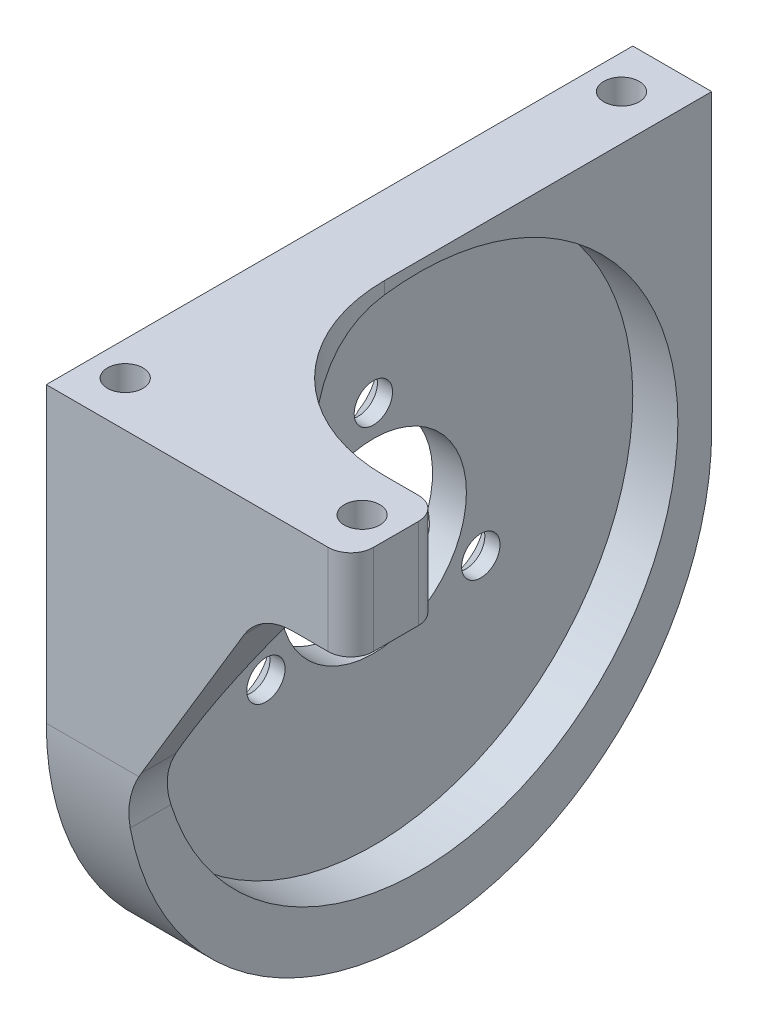
from build123d import *
from OCP.BRepFilletAPI import BRepFilletAPI_MakeChamfer

# Parameters (mm, degrees)
ESBO_O1_W                                      = 52
ESBO_O1_H                                      = 52
RESSALTO_EXTRUS_O1_DEPTH                       = 7
ESBO_O2_R                                      = 8.25
CORTE_EXTRUS_O1_DEPTH                          = 74.87151007
ESCAREADO_PARA_SFHCS_M31_D                     = 3.4
ESCAREADO_PARA_SFHCS_M31_CSINK_D               = 6.72
ESCAREADO_PARA_SFHCS_M31_CSINK_ANGLE           = 90
PADR_OCIRCULAR1_COUNT                          = 3
ESBO_O27_R                                     = 23
CORTE_EXTRUS_O5_DEPTH                          = 4
FILETE1_R                                      = 26
FURO_ROSCADO_PARA_CONDU_TE_DE_M3X0_51_AT_COUNT = 2
FURO_ROSCADO_PARA_CONDU_TE_DE_M3X0_51_AT_PITCH = 44
ESBO_O35_W                                     = 20
ESBO_O35_H                                     = 52
RESSALTO_EXTRUS_O2_DEPTH                       = 8
ESBO_O37_R                                     = 23
CORTE_EXTRUS_O6_DEPTH                          = 77.210235533
CHANFRO1_SIZE                                  = 12
CHANFRO1_SIZE2                                 = 20
FILETE2_R                                      = 10
FILETE3_R                                      = 5
CORTE_EXTRUS_O7_REACH                          = 80.339
ESBO_O39_W                                     = 20
ESBO_O39_H                                     = 36
FILETE5_R                                      = 15
FILETE6_R                                      = 2
CORTE_EXTRUS_O9_REACH                          = 80.339
ESBO_O43_W                                     = 39.515082023
ESBO_O43_H                                     = 58.102579794


with BuildPart() as part:
    # Esboço1 → Ressalto-extrusão1 (new body)
    with BuildSketch(Plane(origin=(0, 0, 0), x_dir=(0, 0, -1), z_dir=(1, 0, 0))):
        with Locations((26, 26)):
            Rectangle(ESBO_O1_W, ESBO_O1_H)
    extrude(amount=RESSALTO_EXTRUS_O1_DEPTH)

    # Esboço2 → Corte-extrusão1 (cut, through all)
    with BuildSketch(Plane.ZY):
        with Locations((-26, 28.1)):
            Circle(ESBO_O2_R)
    extrude(amount=-CORTE_EXTRUS_O1_DEPTH, mode=Mode.SUBTRACT)

    # Escareado para SFHCS M31 (through all)
    with Locations(Plane.ZY):
        with Locations((-26, 39.1)):
            escareado_para_sfhcs_m31 = CounterSinkHole(ESCAREADO_PARA_SFHCS_M31_D / 2, ESCAREADO_PARA_SFHCS_M31_CSINK_D / 2, counter_sink_angle=ESCAREADO_PARA_SFHCS_M31_CSINK_ANGLE)

    # PadrãoCircular1: Escareado para SFHCS M31 ×3 about axis
    padr_ocircular1_axis = Axis((0, 28.1, -26), (1, 0, 0))
    for i in range(1, PADR_OCIRCULAR1_COUNT):
        add(escareado_para_sfhcs_m31.rotate(padr_ocircular1_axis, i * 360 / PADR_OCIRCULAR1_COUNT), mode=Mode.SUBTRACT)

    # Esboço27 → Corte-extrusão5 (cut)
    with BuildSketch(Plane(origin=(7, 0, 0), x_dir=(0, 0, -1), z_dir=(1, 0, 0))):
        with Locations((26, 28.1)):
            Circle(ESBO_O27_R)
    extrude(amount=-CORTE_EXTRUS_O5_DEPTH, mode=Mode.SUBTRACT)

    # Filete1
    filete1_edges = [part.edges().sort_by_distance(p)[0] for p in [
        (3.5, 0, -52),
        (3.5, 0, 0),
    ]]
    fillet(filete1_edges, radius=FILETE1_R - 0.0001)  # a hair under: the kernel refuses the full size

    # Esboço34 → Furo roscado para conduíte de M3x0.51 (revolve, cut)
    with BuildSketch(Plane(origin=(3, 52, -48), x_dir=(0, 0, 1), z_dir=(1, 0, 0))):
        Polygon((0, 0), (0, 10.946355475), (1.575, 10), (1.575, 0), align=None)
    furo_roscado_para_condu_te_de_m3x0_51 = revolve(axis=Axis((3, 58.35, -48), (0, -1, 0)), mode=Mode.SUBTRACT)

    # Furo roscado para conduíte de M3x0.51 at: Furo roscado para conduíte de M3x0.51 ×2
    with Locations(*[(0, 0, i * FURO_ROSCADO_PARA_CONDU_TE_DE_M3X0_51_AT_PITCH) for i in range(1, FURO_ROSCADO_PARA_CONDU_TE_DE_M3X0_51_AT_COUNT)]):
        add(furo_roscado_para_condu_te_de_m3x0_51, mode=Mode.SUBTRACT)

    # Esboço35 → Ressalto-extrusão2 (add)
    with BuildSketch(Plane(origin=(0, 52, 0), x_dir=(1, 0, 0), z_dir=(0, 1, 0))):
        with Locations((17, 26)):
            Rectangle(ESBO_O35_W, ESBO_O35_H)
    extrude(amount=-RESSALTO_EXTRUS_O2_DEPTH)

    # Esboço37 → Corte-extrusão6 (cut, through all)
    with BuildSketch(Plane(origin=(7, 0, 0), x_dir=(0, 0, -1), z_dir=(1, 0, 0))):
        with Locations((26, 28.1)):
            Circle(ESBO_O37_R)
    extrude(amount=CORTE_EXTRUS_O6_DEPTH, mode=Mode.SUBTRACT)

    # Chanfro1: one chamfer whose edges measure the first distance from different faces: ONE call of the kernel's chamfer builder (chamfer() names one face for all edges)
    chanfro1_edges_1 = [part.edges().sort_by_distance(p)[0] for p in [
        (7, 44, -47.309482535),
    ]]
    chanfro1_side_1 = [part.faces().sort_by_distance(p)[0] for p in [
        (17, 44, -47.309482535),
    ]]
    chanfro1_edges_2 = [part.edges().sort_by_distance(p)[0] for p in [
        (7, 44, -4.690517465),
    ]]
    chanfro1_side_2 = [part.faces().sort_by_distance(p)[0] for p in [
        (17, 44, -4.690517465),
    ]]
    chanfro1 = BRepFilletAPI_MakeChamfer(part.part.solid().wrapped)
    for e in chanfro1_edges_1:
        chanfro1.Add(CHANFRO1_SIZE, CHANFRO1_SIZE2, e.wrapped, chanfro1_side_1[0].wrapped)  # the first distance lies on this face
    for e in chanfro1_edges_2:
        chanfro1.Add(CHANFRO1_SIZE, CHANFRO1_SIZE2, e.wrapped, chanfro1_side_2[0].wrapped)  # the first distance lies on this face
    add(Compound.cast(chanfro1.Shape()), mode=Mode.REPLACE)

    # Filete2
    filete2_edges = [part.edges().sort_by_distance(p)[0] for p in [
        (7, 24, -1.722707367),
        (7, 24, -50.277292633),
    ]]
    fillet(filete2_edges, radius=FILETE2_R)

    # Filete3
    filete3_edges = [part.edges().sort_by_distance(p)[0] for p in [
        (19, 44, -4.690517465),
        (19, 44, -47.309482535),
    ]]
    fillet(filete3_edges, radius=FILETE3_R)

    # Espelhar1: Furo roscado para conduíte de M3x0.51 across plane
    add(furo_roscado_para_condu_te_de_m3x0_51.mirror(Plane.ZY.offset(-13.5)), mode=Mode.SUBTRACT)

    # Espelhar1 copy 1 sketch → Espelhar1 copy 1 (revolve, cut)
    with BuildSketch(Plane(origin=(24, 52, -4), x_dir=(0, 0, 1), z_dir=(-1, 0, 0))):
        Polygon((0, 0), (0, -10.946355475), (1.575, -10), (1.575, 0), align=None)
    revolve(axis=Axis((24, 58.35, -4), (0, 1, 0)), mode=Mode.SUBTRACT)

    # Esboço39 → Corte-extrusão7 (cut, up to next)
    with BuildSketch(Plane(origin=(0, 52, 0), x_dir=(1, 0, 0), z_dir=(0, 1, 0)), mode=Mode.PRIVATE) as corte_extrus_o7_sk1:
        with Locations((17, 26)):
            Rectangle(ESBO_O39_W, ESBO_O39_H)
    corte_extrus_o7_tool1 = extrude(corte_extrus_o7_sk1.sketch, amount=-CORTE_EXTRUS_O7_REACH, mode=Mode.PRIVATE) & part.part
    add(corte_extrus_o7_tool1.solids().sort_by_distance((17, 52, -26))[0], mode=Mode.SUBTRACT)

    # Filete5
    filete5_edges = [part.edges().sort_by_distance(p)[0] for p in [
        (7, 47.208910532, -44),
        (7, 47.208910532, -8),
    ]]
    fillet(filete5_edges, radius=FILETE5_R)

    # Filete6
    filete6_edges = [part.edges().sort_by_distance(p)[0] for p in [
        (27, 48, -44),
        (27, 48, -8),
        (27, 48, -52),
        (27, 48, 0),
    ]]
    fillet(filete6_edges, radius=FILETE6_R)

    # Esboço43 → Corte-extrusão9 (cut, up to next)
    with BuildSketch(Plane(origin=(0, 0, -52), x_dir=(-1, 0, 0), z_dir=(0, 0, -1)), mode=Mode.PRIVATE) as corte_extrus_o9_sk1:
        with Locations((-26.757541012, 29.051289897)):
            Rectangle(ESBO_O43_W, ESBO_O43_H)
    corte_extrus_o9_tool1 = extrude(corte_extrus_o9_sk1.sketch, amount=-CORTE_EXTRUS_O9_REACH, mode=Mode.PRIVATE) & part.part
    add(corte_extrus_o9_tool1.solids().sort_by_distance((26.757541, 29.05129, -52))[0], mode=Mode.SUBTRACT)


solid = part.part
